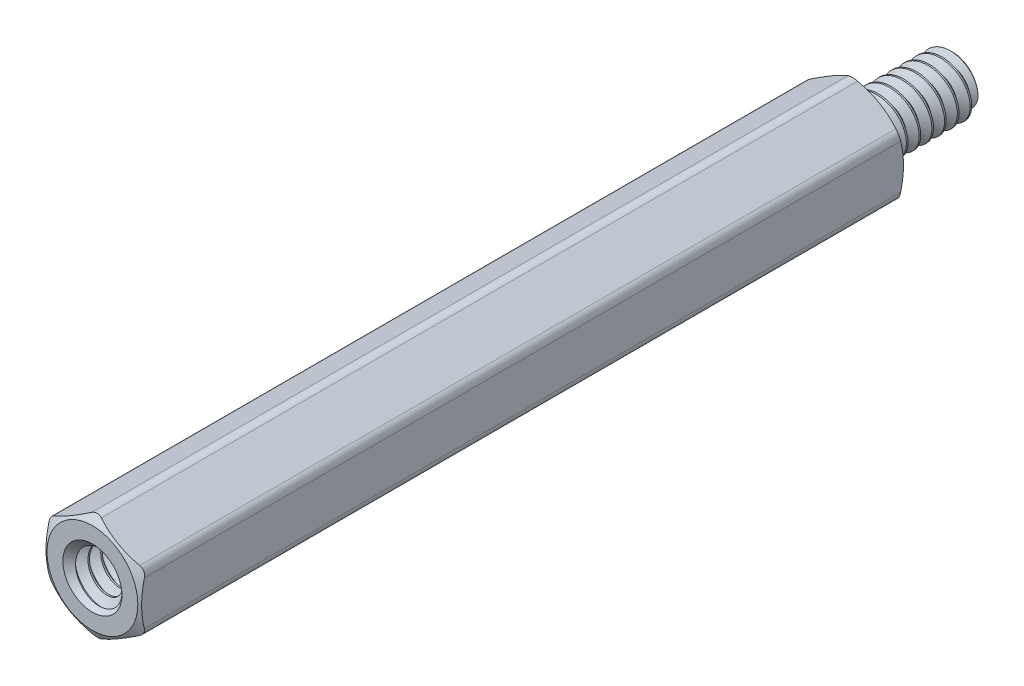
from build123d import *

# Parameters (mm, degrees)
SKETCH4_R           = 1.901825
BOSS_EXTRUDE1_DEPTH = 38.1
SKETCH5_OUTSIDE_W   = 167.934
SKETCH5_OUTSIDE_H   = 168.672
SKETCH5_OUTSIDE_R   = 2.2621875
CUT_EXTRUDE1_DEPTH  = 44.016563398
CUT_EXTRUDE1_DRAFT  = -60
SKETCH6_OUTSIDE_W   = 151.504
SKETCH6_OUTSIDE_H   = 152.242
SKETCH6_OUTSIDE_R   = 2.2621875
CUT_EXTRUDE2_DEPTH  = 39.273238958
CUT_EXTRUDE2_DRAFT  = -60
FILLET1_R           = 0.47625
CUT_SWEEP1_PITCH    = 0.635
SKETCH9_R           = 1.58115
BOSS_EXTRUDE2_DEPTH = 6.35
SKETCH10_W          = 6.35
SKETCH10_H          = 1.4224
CUT_SWEEP2_PITCH    = 0.635


with BuildPart() as part:
    # Sketch3 → Revolve1 (revolve)
    with BuildSketch(Plane(origin=(0, 0, 0), x_dir=(0, 0, -1), z_dir=(1, 0, 0))):
        with BuildLine():
            Line((-31.75, 1.26365), (-31.75, 0))
            Line((-31.75, 0), (4.7625, 0))
            Line((4.7625, 0), (4.7625, 1.26365))
            Line((4.7625, 1.26365), (4.60375, 1.4224))
            Line((4.60375, 1.4224), (0.809625, 1.4224))
            Line((0.809625, 1.4224), (0.5715, 1.009955401))
            Line((0.5715, 1.009955401), (0.15875, 1.009955401))
            ThreePointArc((0.15875, 1.009955401), (0.046496798, 1.0564522), (0, 1.168705401))
            Line((0, 1.168705401), (0, 2.38125))
            Line((0, 2.38125), (-38.1, 2.38125))
            Line((-38.1, 2.38125), (-38.1, 1.58115))
            Line((-38.1, 1.58115), (-37.94125, 1.4224))
            Line((-37.94125, 1.4224), (-31.90875, 1.4224))
            Line((-31.90875, 1.4224), (-31.75, 1.26365))
        make_face()
    revolve(axis=Axis((0, 0, -4.7625), (0, 0, 1)))

    # Sketch4 → Boss-Extrude1 (add)
    with BuildSketch(Plane.XY.offset(38.1)):
        Polygon((-2.38125, 1.374815329), (-2.38125, -1.374815329), (0, -2.749630657), (2.38125, -1.374815329), (2.38125, 1.374815329), (0, 2.749630657), align=None)
        Circle(SKETCH4_R, mode=Mode.SUBTRACT)
    extrude(amount=-BOSS_EXTRUDE1_DEPTH)


with BuildPart() as cut_extrude1_tool:
    # Sketch5 outside → Cut-Extrude1 (with draft: the straight prism first)
    with BuildSketch(Plane.XY.offset(38.1)):
        Rectangle(SKETCH5_OUTSIDE_W, SKETCH5_OUTSIDE_H)
        Circle(SKETCH5_OUTSIDE_R, mode=Mode.SUBTRACT)
    extrude(amount=-CUT_EXTRUDE1_DEPTH)
    # Cut-Extrude1: the draft: its side faces are tilted about the plane it starts from
    cut_extrude1_sides = [cut_extrude1_tool.faces().sort_by_distance(p)[0] for p in [
        (0, -84.336, 16.091718301),
        (83.967, 0, 16.091718301),
        (0, 84.336, 16.091718301),
        (-83.967, 0, 16.091718301),
        (-2.2621875, 0, 16.091718301),
    ]]
    draft(cut_extrude1_sides, Plane.XY.offset(38.1), CUT_EXTRUDE1_DRAFT)


with BuildPart() as part_1:
    add(part.part)

    # Cut-Extrude1: cut by cut_extrude1_tool
    add(cut_extrude1_tool.part, mode=Mode.SUBTRACT)


with BuildPart() as cut_extrude2_tool:
    # Sketch6 outside → Cut-Extrude2 (with draft: the straight prism first)
    with BuildSketch(Plane(origin=(0, 0, 0), x_dir=(-1, 0, 0), z_dir=(0, 0, -1))):
        Rectangle(SKETCH6_OUTSIDE_W, SKETCH6_OUTSIDE_H)
        Circle(SKETCH6_OUTSIDE_R, mode=Mode.SUBTRACT)
    extrude(amount=-CUT_EXTRUDE2_DEPTH)
    # Cut-Extrude2: the draft: its side faces are tilted about the plane it starts from
    cut_extrude2_sides = [cut_extrude2_tool.faces().sort_by_distance(p)[0] for p in [
        (0, -76.121, 19.636619479),
        (-75.752, 0, 19.636619479),
        (0, 76.121, 19.636619479),
        (75.752, 0, 19.636619479),
        (2.2621875, 0, 19.636619479),
    ]]
    draft(cut_extrude2_sides, Plane(origin=(0, 0, 0), x_dir=(-1, 0, 0), z_dir=(0, 0, -1)), CUT_EXTRUDE2_DRAFT)


with BuildPart() as part_2:
    add(part_1.part)

    # Cut-Extrude2: cut by cut_extrude2_tool
    add(cut_extrude2_tool.part, mode=Mode.SUBTRACT)

    # Fillet1
    fillet1_edges = [part_2.edges().sort_by_distance(p)[0] for p in [
        (0, 2.749630657, 19.05),
        (-2.38125, -1.374815329, 19.05),
        (0, -2.749630657, 19.05),
        (2.38125, -1.374815329, 19.05),
        (2.38125, 1.374815329, 19.05),
        (-2.38125, 1.374815329, 19.05),
    ]]
    fillet(fillet1_edges, radius=FILLET1_R)

    # Cut-Sweep1: the profile of Sketch7 profile screwed along a right-hand helix of 7.275 turns, 6 arcs to a turn; built about Z, then put on its axis
    cut_sweep1_z = Axis((0, 0, 0), (0, 0, 1))
    cut_sweep1_corners = [(1.009655401, 0, -0.238298205), (1.009655401, 0, -0.317326795), (1.456770383, 0, -0.57546875), (1.456770383, 0, 0.01984375)]
    with BuildLine(mode=Mode.PRIVATE) as cut_sweep1_profile:
        Line(cut_sweep1_corners[0], cut_sweep1_corners[1])
        Line(cut_sweep1_corners[1], cut_sweep1_corners[2])
        Line(cut_sweep1_corners[2], cut_sweep1_corners[3])
        Line(cut_sweep1_corners[3], cut_sweep1_corners[0])
    cut_sweep1_cap = Face(cut_sweep1_profile.wire())
    cut_sweep1_turn_angles = [0, 30, 60, 90, 120, 150, 180, 210, 240, 270, 300, 330, 360]
    cut_sweep1_turn_weights = [1, 0.8660254037844387, 1, 0.8660254037844387, 1, 0.8660254037844387, 1, 0.8660254037844387, 1, 0.8660254037844387, 1, 0.8660254037844387, 1]
    cut_sweep1_turn_rails = [Edge.make_bspline([Vector(p[0], p[1], 0).rotate(cut_sweep1_z, cut_sweep1_turn_angles[k]) / cut_sweep1_turn_weights[k] + Vector(0, 0, p[2] + CUT_SWEEP1_PITCH * cut_sweep1_turn_angles[k] / 360) for k in range(13)], [0, 0, 0, 1, 1, 2, 2, 3, 3, 4, 4, 5, 5, 6, 6, 6], 2, cut_sweep1_turn_weights) for p in cut_sweep1_corners]
    cut_sweep1_turn_sides = [Face.make_surface_from_curves(cut_sweep1_turn_rails[p[0]], cut_sweep1_turn_rails[p[1]]) for p in [(0, 1), (1, 2), (2, 3), (3, 0)]]
    cut_sweep1_last_angles = [2520, 2550, 2580, 2599.5, 2619]
    cut_sweep1_last_weights = [1, 0.8660254037844387, 1, 0.9426414910921771, 1]
    cut_sweep1_last_rails = [Edge.make_bspline([Vector(p[0], p[1], 0).rotate(cut_sweep1_z, cut_sweep1_last_angles[k]) / cut_sweep1_last_weights[k] + Vector(0, 0, p[2] + CUT_SWEEP1_PITCH * cut_sweep1_last_angles[k] / 360) for k in range(5)], [0, 0, 0, 1, 1, 2, 2, 2], 2, cut_sweep1_last_weights) for p in cut_sweep1_corners]
    cut_sweep1_last_sides = [Face.make_surface_from_curves(cut_sweep1_last_rails[p[0]], cut_sweep1_last_rails[p[1]]) for p in [(0, 1), (1, 2), (2, 3), (3, 0)]]
    cut_sweep1 = Plane(origin=(0, 0, -4.7625), x_dir=(0, 1, 0), z_dir=(0, 0, 1)) * Solid(Shell([*[p.moved(Location((0, 0, CUT_SWEEP1_PITCH * i))) for i in range(7) for p in cut_sweep1_turn_sides], *cut_sweep1_last_sides, cut_sweep1_cap, cut_sweep1_cap.rotate(cut_sweep1_z, 2619).moved(Location((0, 0, CUT_SWEEP1_PITCH * 2619 / 360)))]))
    add(cut_sweep1, mode=Mode.SUBTRACT)

    # Sketch9 → Boss-Extrude2 (add)
    with BuildSketch(Plane.XY.offset(31.75)):
        Circle(SKETCH9_R)
    extrude(amount=BOSS_EXTRUDE2_DEPTH)


with BuildPart() as body_2:
    # Sketch10 → Revolve2 (revolve)
    with BuildSketch(Plane(origin=(0, 0, 0), x_dir=(0, 0, -1), z_dir=(1, 0, 0))):
        with Locations((-34.925, 0.7112)):
            Rectangle(SKETCH10_W, SKETCH10_H)
    revolve(axis=Axis((0, 0, -4.7625), (0, 0, 1)))

    # Cut-Sweep2: the profile of Sketch12 profile screwed along a right-hand helix of 11 turns, 6 arcs to a turn; built about Z, then put on its axis
    cut_sweep2_z = Axis((0, 0, 0), (0, 0, 1))
    cut_sweep2_corners = [(1.009655401, 0, -0.317326795), (1.009655401, 0, -0.238298205), (1.456770383, 0, 0.01984375), (1.456770383, 0, -0.57546875)]
    with BuildLine(mode=Mode.PRIVATE) as cut_sweep2_profile:
        Line(cut_sweep2_corners[0], cut_sweep2_corners[1])
        Line(cut_sweep2_corners[1], cut_sweep2_corners[2])
        Line(cut_sweep2_corners[2], cut_sweep2_corners[3])
        Line(cut_sweep2_corners[3], cut_sweep2_corners[0])
    cut_sweep2_cap = Face(cut_sweep2_profile.wire())
    cut_sweep2_turn_angles = [0, 30, 60, 90, 120, 150, 180, 210, 240, 270, 300, 330, 360]
    cut_sweep2_turn_weights = [1, 0.8660254037844387, 1, 0.8660254037844387, 1, 0.8660254037844387, 1, 0.8660254037844387, 1, 0.8660254037844387, 1, 0.8660254037844387, 1]
    cut_sweep2_turn_rails = [Edge.make_bspline([Vector(p[0], p[1], 0).rotate(cut_sweep2_z, cut_sweep2_turn_angles[k]) / cut_sweep2_turn_weights[k] + Vector(0, 0, p[2] + CUT_SWEEP2_PITCH * cut_sweep2_turn_angles[k] / 360) for k in range(13)], [0, 0, 0, 1, 1, 2, 2, 3, 3, 4, 4, 5, 5, 6, 6, 6], 2, cut_sweep2_turn_weights) for p in cut_sweep2_corners]
    cut_sweep2_turn_sides = [Face.make_surface_from_curves(cut_sweep2_turn_rails[p[0]], cut_sweep2_turn_rails[p[1]]) for p in [(0, 1), (1, 2), (2, 3), (3, 0)]]
    cut_sweep2 = Plane(origin=(0, 0, 38.1), x_dir=(0, 1, 0), z_dir=(0, 0, -1)) * Solid(Shell([*[p.moved(Location((0, 0, CUT_SWEEP2_PITCH * i))) for i in range(11) for p in cut_sweep2_turn_sides], cut_sweep2_cap, cut_sweep2_cap.rotate(cut_sweep2_z, 3960).moved(Location((0, 0, CUT_SWEEP2_PITCH * 3960 / 360)))]))
    add(cut_sweep2, mode=Mode.SUBTRACT)


with BuildPart() as part_3:
    add(part_2.part)

    # Combine1: cut body 2
    add(body_2.part, mode=Mode.SUBTRACT)

    # Cut-Extrude3 cone 1 section (through the dimple's axis) → Cut-Extrude3 (revolve, cut)
    with BuildSketch(Plane(origin=(0, 0, 38.1), x_dir=(0, -1, 0), z_dir=(1, 0, 0))):
        Polygon((0, 0), (1.4732, 0), (0, 1.4732), align=None)
    revolve(axis=Axis((0, 0, 38.1), (0, 0, -1)), mode=Mode.SUBTRACT)


solid = part_3.part
